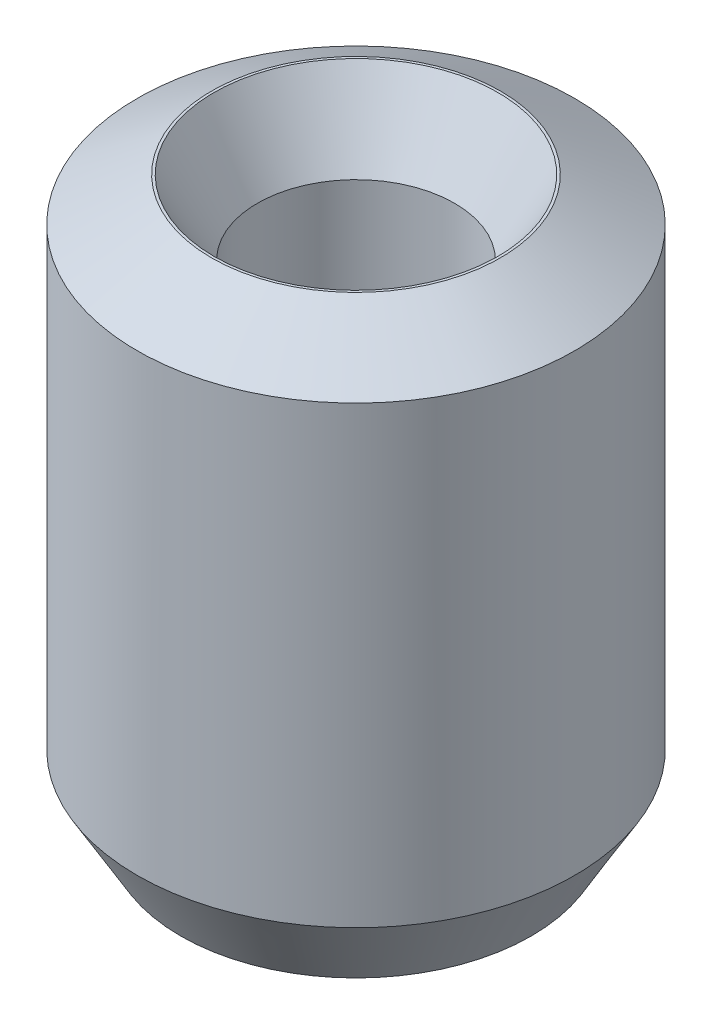
from build123d import *
from OCP.BRepFilletAPI import BRepFilletAPI_MakeChamfer

# Parameters (mm, degrees)
SKETCH1_R           = 20
BOSS_EXTRUDE1_DEPTH = 52.304985228
SKETCH2_R           = 9.01498921
CUT_EXTRUDE1_DEPTH  = 60.462689813
CHAMFER1_SIZE       = 3.96905197
CHAMFER1_SIZE2      = 6.784753198


with BuildPart() as part:
    # Sketch1 → Boss-Extrude1 (new body)
    with BuildSketch(Plane(origin=(0, 0, 0), x_dir=(1, 0, 0), z_dir=(0, 1, 0))):
        Circle(SKETCH1_R)
    extrude(amount=BOSS_EXTRUDE1_DEPTH)

    # Sketch2 → Cut-Extrude1 (cut, through all)
    with BuildSketch(Plane(origin=(0, 0, 0), x_dir=(1, 0, 0), z_dir=(0, 1, 0))):
        Circle(SKETCH2_R)
    extrude(amount=CUT_EXTRUDE1_DEPTH, mode=Mode.SUBTRACT)

    # Chamfer1: one chamfer whose edges measure the first distance from different faces: ONE call of the kernel's chamfer builder (chamfer() names one face for all edges)
    chamfer1_edges_1 = [part.edges().sort_by_distance(p)[0] for p in [
        (-9.01498921, 52.304985228, 0),
    ]]
    chamfer1_side_1 = [part.faces().sort_by_distance(p)[0] for p in [
        (-19.434314575, 52.304985228, 0),
    ]]
    chamfer1_edges_2 = [part.edges().sort_by_distance(p)[0] for p in [
        (-9.01498921, 0, 0),
    ]]
    chamfer1_side_2 = [part.faces().sort_by_distance(p)[0] for p in [
        (-9.01498921, 26.152492614, 0),
    ]]
    chamfer1_edges_3 = [part.edges().sort_by_distance(p)[0] for p in [
        (-20, 0, 0),
    ]]
    chamfer1_side_3 = [part.faces().sort_by_distance(p)[0] for p in [
        (-19.434314575, 0, 0),
    ]]
    chamfer1_edges_4 = [part.edges().sort_by_distance(p)[0] for p in [
        (-20, 52.304985228, 0),
    ]]
    chamfer1_side_4 = [part.faces().sort_by_distance(p)[0] for p in [
        (-20, 26.152492614, 0),
    ]]
    chamfer1 = BRepFilletAPI_MakeChamfer(part.part.solid().wrapped)
    for e in chamfer1_edges_1:
        chamfer1.Add(CHAMFER1_SIZE, CHAMFER1_SIZE2, e.wrapped, chamfer1_side_1[0].wrapped)  # the first distance lies on this face
    for e in chamfer1_edges_2:
        chamfer1.Add(CHAMFER1_SIZE, CHAMFER1_SIZE2, e.wrapped, chamfer1_side_2[0].wrapped)  # the first distance lies on this face
    for e in chamfer1_edges_3:
        chamfer1.Add(CHAMFER1_SIZE, CHAMFER1_SIZE2, e.wrapped, chamfer1_side_3[0].wrapped)  # the first distance lies on this face
    for e in chamfer1_edges_4:
        chamfer1.Add(CHAMFER1_SIZE, CHAMFER1_SIZE2, e.wrapped, chamfer1_side_4[0].wrapped)  # the first distance lies on this face
    add(Compound.cast(chamfer1.Shape()), mode=Mode.REPLACE)


solid = part.part
